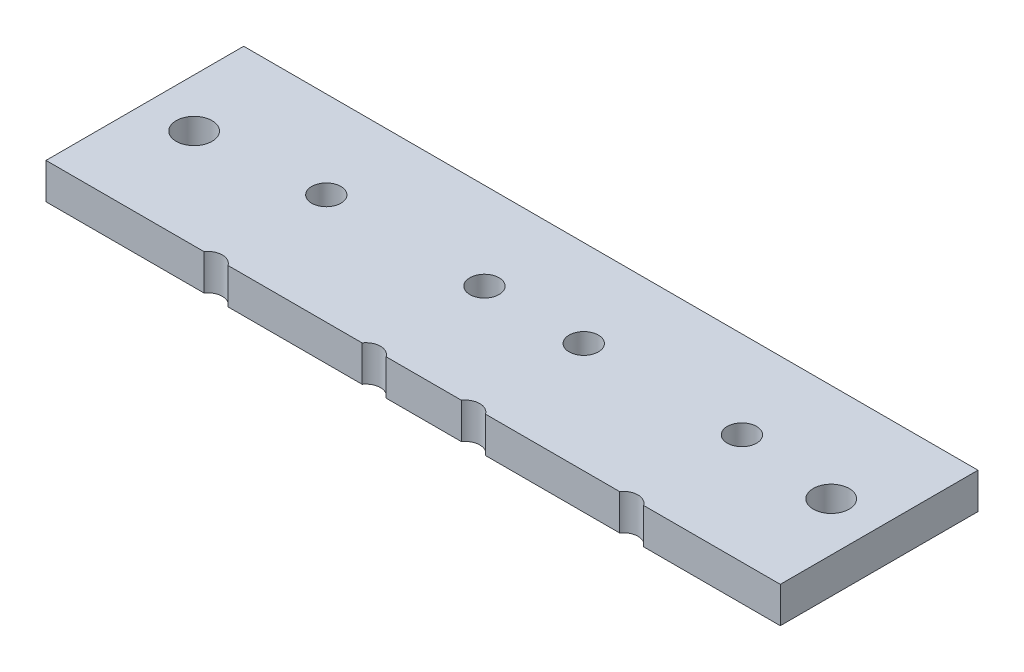
from build123d import *

# Parameters (mm, degrees)
SKETCH1_W           = 130
SKETCH1_H           = 35
BOSS_EXTRUDE1_DEPTH = 6.35
SKETCH5_R           = 3.18
CUT_EXTRUDE2_DEPTH  = 135.778790987
SKETCH8_R           = 2.58660254
CUT_EXTRUDE4_DEPTH  = 135.778790987


with BuildPart() as part:
    # Sketch1 → Boss-Extrude1 (new body)
    with BuildSketch(Plane(origin=(0, 0, 0), x_dir=(1, 0, 0), z_dir=(0, 1, 0))):
        with Locations((65, -17.5)):
            Rectangle(SKETCH1_W, SKETCH1_H)
    extrude(amount=BOSS_EXTRUDE1_DEPTH)

    # Sketch5 → Cut-Extrude2 (cut, through all)
    with BuildSketch(Plane(origin=(0, 6.35, 0), x_dir=(1, 0, 0), z_dir=(0, 1, 0))):
        with Locations((8.605, -17.382603272)):
            Circle(SKETCH5_R)
        with Locations((121.395, -17.382603272)):
            Circle(SKETCH5_R)
    extrude(amount=-CUT_EXTRUDE2_DEPTH, mode=Mode.SUBTRACT)

    # Sketch8 → Cut-Extrude4 (cut, through all)
    with BuildSketch(Plane.XZ):
        with Locations((30.09254413, 15.470341269)):
            Circle(SKETCH8_R)
        with Locations((30.09254413, 36.470341269)):
            Circle(SKETCH8_R)
        with Locations((58.09254413, 36.470341269)):
            Circle(SKETCH8_R)
        with Locations((58.09254413, 15.470341269)):
            Circle(SKETCH8_R)
        with Locations((75.674496257, 15.470341269)):
            Circle(SKETCH8_R)
        with Locations((75.674496257, 36.470341269)):
            Circle(SKETCH8_R)
        with Locations((103.674496257, 15.470341269)):
            Circle(SKETCH8_R)
        with Locations((103.674496257, 36.470341269)):
            Circle(SKETCH8_R)
    extrude(amount=-CUT_EXTRUDE4_DEPTH, mode=Mode.SUBTRACT)


solid = part.part
